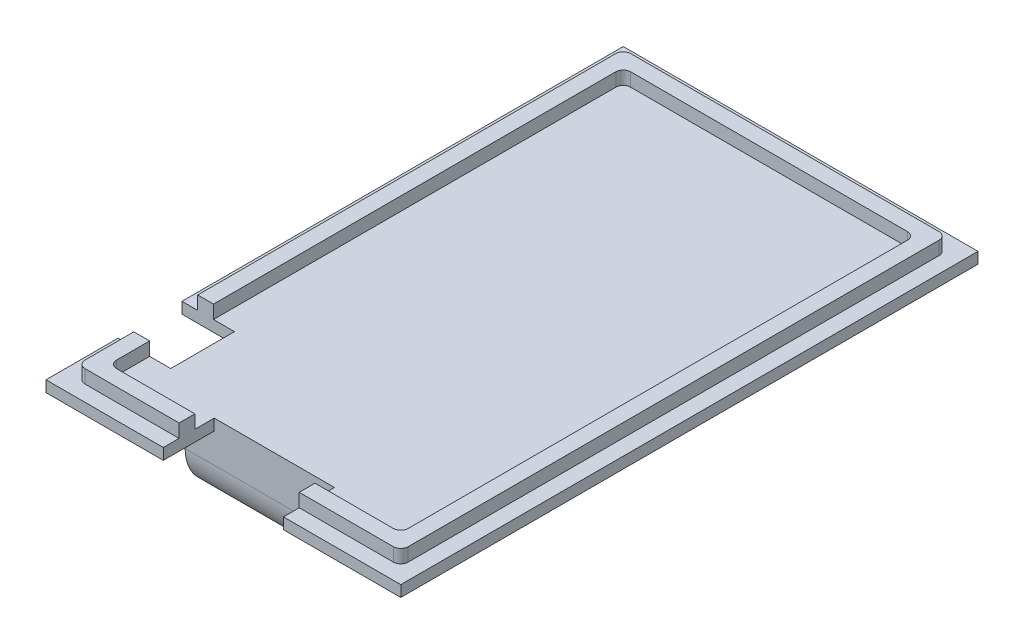
from build123d import *

# Parameters (mm, degrees)
PCB_DIMENSIONS_W    = 47.716732244
PCB_DIMENSIONS_H    = 77.636732244
BOSS_EXTRUDE3_DEPTH = 1.5
SKETCH5_W           = 43.474091557
SKETCH5_H           = 73.394091557
SKETCH5_W_2         = 39.23145087
SKETCH5_H_2         = 69.15145087
BOSS_EXTRUDE4_DEPTH = 1.8
FILLET1_R           = 1
SKETCH6_W           = 24
SKETCH6_H           = 64
BOSS_EXTRUDE5_DEPTH = 10
SKETCH7_W           = 48
SKETCH7_H           = 6
CUT_EXTRUDE1_DEPTH  = 24
FILLET2_R           = 6
FILLET3_R           = 1
SCALE1_SCALE        = 0.99
CUT_EXTRUDE2_DEPTH  = 10
SKETCH9_W           = 7
SKETCH9_H           = 8.5
CUT_EXTRUDE3_DEPTH  = 10


with BuildPart() as part:
    # PCB Dimensions → Boss-Extrude3 (new body)
    with BuildSketch(Plane(origin=(0, 0, 0), x_dir=(1, 0, 0), z_dir=(0, 1, 0))):
        with Locations((20.322832216, -35.282832216)):
            Rectangle(PCB_DIMENSIONS_W, PCB_DIMENSIONS_H)
    extrude(amount=BOSS_EXTRUDE3_DEPTH)

    # Sketch5 → Boss-Extrude4 (add)
    with BuildSketch(Plane(origin=(0, 1.5, 0), x_dir=(1, 0, 0), z_dir=(0, 1, 0))):
        with Locations((20.322832217, -35.282832217)):
            Rectangle(SKETCH5_W, SKETCH5_H)
        with Locations((20.322832216, -35.282832216)):
            Rectangle(SKETCH5_W_2, SKETCH5_H_2, mode=Mode.SUBTRACT)
    extrude(amount=BOSS_EXTRUDE4_DEPTH)

    # Fillet1
    fillet1_edges = [part.edges().sort_by_distance(p)[0] for p in [
        (0.707106781, 2.4, 69.858557651),
        (-1.414213562, 2.4, 71.979877995),
        (39.938557651, 2.4, 69.858557651),
        (42.059877995, 2.4, 71.979877995),
        (0.707106781, 2.4, 0.707106781),
        (39.938557651, 2.4, 0.707106781),
        (42.059877995, 2.4, -1.414213562),
        (-1.414213562, 2.4, -1.414213562),
    ]]
    fillet(fillet1_edges, radius=FILLET1_R)

    # Sketch6 → Boss-Extrude5 (add)
    with BuildSketch(Plane.XZ):
        with Locations((20.322832216, 35.249738628)):
            Rectangle(SKETCH6_W, SKETCH6_H)
    extrude(amount=BOSS_EXTRUDE5_DEPTH)

    # Sketch7 → Cut-Extrude1 (cut)
    with BuildSketch(Plane(origin=(32.322832216, 0, 0), x_dir=(0, 0, -1), z_dir=(1, 0, 0))):
        with Locations((-35.249738628, -3)):
            Rectangle(SKETCH7_W, SKETCH7_H)
    extrude(amount=-CUT_EXTRUDE1_DEPTH, mode=Mode.SUBTRACT)

    # Fillet2
    fillet2_edges = [part.edges().sort_by_distance(p)[0] for p in [
        (20.322832216, -10, 3.249738628),
        (20.322832216, -10, 67.249738628),
    ]]
    fillet(fillet2_edges, radius=FILLET2_R)

    # Fillet3
    fillet3_edges = [part.edges().sort_by_distance(p)[0] for p in [
        (20.322832216, -6, 11.249738628),
        (20.322832216, -6, 59.249738628),
    ]]
    fillet(fillet3_edges, radius=FILLET3_R)


with BuildPart() as part_1:
    # Scale1: scaled about (20.322832216, -3.218350849, 35.264379677)
    add(part.part.scale(SCALE1_SCALE).moved(Location((0.203228322, -0.032183508, 0.352643797))))

    # Sketch8 → Cut-Extrude2 (cut)
    with BuildSketch(Plane.XZ.offset(0.032183508)):
        Polygon((20.322832216, 73.712830152), (12.322832216, 73.712830152), (12.322832216, 66.929885038), (28.322832216, 66.929885038), (28.322832216, 73.712830152), align=None)
    extrude(amount=-CUT_EXTRUDE2_DEPTH, mode=Mode.SUBTRACT)

    # Sketch9 → Cut-Extrude3 (cut)
    with BuildSketch(Plane.XZ.offset(0.032183508)):
        with Locations((0.203049755, 59.862830152)):
            Rectangle(SKETCH9_W, SKETCH9_H)
    extrude(amount=-CUT_EXTRUDE3_DEPTH, mode=Mode.SUBTRACT)


solid = part_1.part
